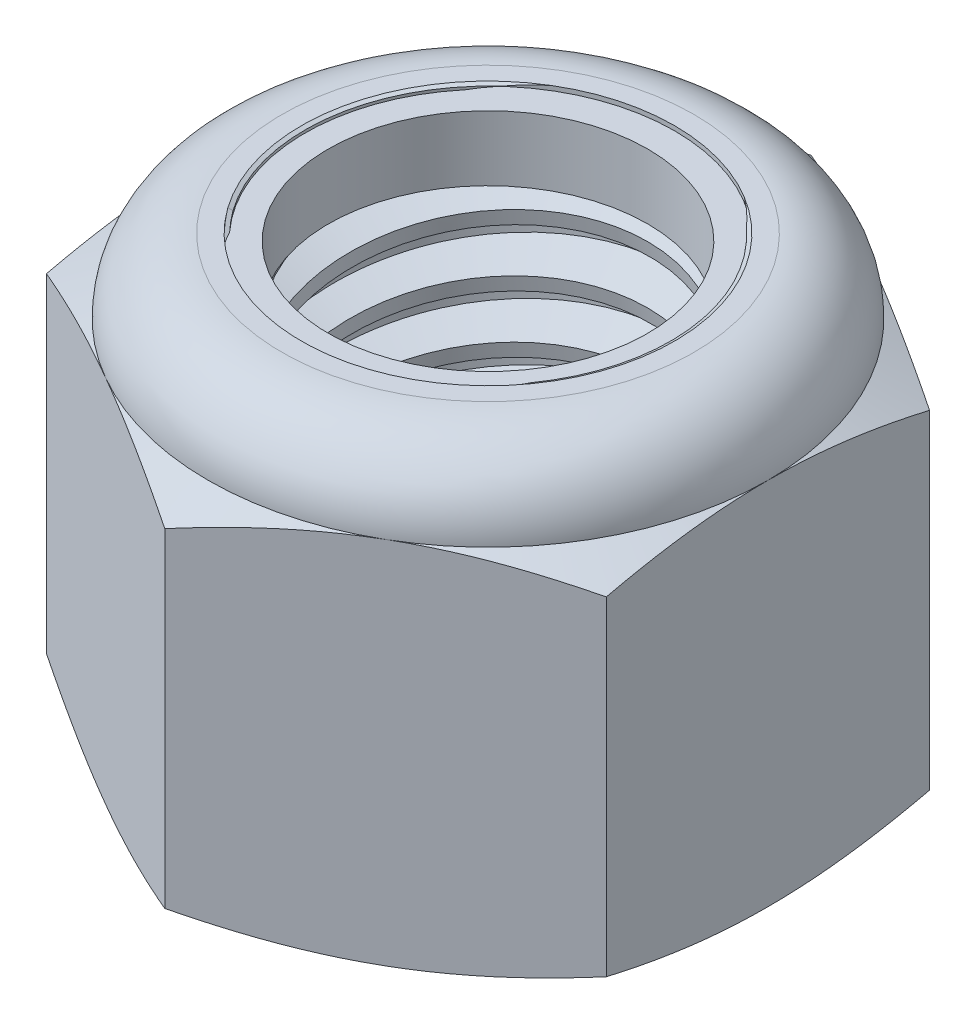
from build123d import *

# Parameters (mm, degrees)
EXTRUDE1_DEPTH       = 15.08125
SKETCH2_W            = 6.35
SKETCH2_H            = 15.08125
LPATTERN1_COUNT      = 8
LPATTERN1_PITCH      = 1.953846154
LPATTERN1_COUNT_DIR2 = 2
LPATTERN1_PITCH_DIR2 = 1.953846154


with BuildPart() as part:
    # Sketch1 → Extrude1 (new body)
    with BuildSketch(Plane(origin=(0, 0, 0), x_dir=(1, 0, 0), z_dir=(0, 1, 0))):
        Polygon((0, 10.998522628), (-9.525, 5.499261314), (-9.525, -5.499261314), (0, -10.998522628), (9.525, -5.499261314), (9.525, 5.499261314), align=None)
    extrude(amount=EXTRUDE1_DEPTH)

    # Sketch4 → Cut-Revolve2 (revolve, cut)
    with BuildSketch(Plane(origin=(0, 0, 0), x_dir=(0, 0, -1), z_dir=(1, 0, 0))):
        Polygon((0, 15.08125), (6.35, 15.08125), (5.434726912, 14.65445115), (5.434726912, 0.42679885), (6.35, 0), (0, 0), align=None)
    revolve(axis=Axis((0, 15.08125, 0), (0, 1, 0)), mode=Mode.SUBTRACT)


with BuildPart() as body_2:
    # Sketch2 → Revolve1 (revolve)
    with BuildSketch(Plane(origin=(0, 0, 0), x_dir=(0, 0, -1), z_dir=(1, 0, 0))):
        with Locations((3.175, 7.540625)):
            Rectangle(SKETCH2_W, SKETCH2_H)
    revolve(axis=Axis((0, -6.35, 0), (0, 1, 0)))

    # Sketch3 → Cut-Revolve1 (revolve, cut)
    with BuildSketch(Plane(origin=(0, 0, 0), x_dir=(0, 0, -1), z_dir=(1, 0, 0))):
        Polygon((6.387137043, 14.83985922), (6.647096345, 13.15012376), (5.509000998, 13.592792596), (5.434726912, 14.075574156), align=None)
    cut_revolve1 = revolve(axis=Axis((0, 15.08125, 0.321367977), (0, -0.9883716976506172, -0.15205718425394146)), mode=Mode.SUBTRACT)

    # LPattern1: Cut-Revolve1 8 × 2
    with Locations(*[Vector(0, -1, 0) * (i * LPATTERN1_PITCH) + Vector(0, 1, 0) * (j * LPATTERN1_PITCH_DIR2) for i in range(LPATTERN1_COUNT) for j in range(LPATTERN1_COUNT_DIR2) if (i, j) != (0, 0)]):
        add(cut_revolve1, mode=Mode.SUBTRACT)


with BuildPart() as part_1:
    add(part.part)

    # Combine1: cut body 2
    add(body_2.part, mode=Mode.SUBTRACT)

    # Sketch5 → Cut-Revolve3 (revolve, cut)
    with BuildSketch(Plane(origin=(0, 0, 0), x_dir=(0, 0, -1), z_dir=(1, 0, 0))):
        with BuildLine():
            Line((0, 0), (9.525, 0))
            Line((9.525, 0), (10.998522628, 0.687114886))
            Line((10.998522628, 0.687114886), (10.998522628, 11.880593447))
            Line((10.998522628, 11.880593447), (9.525, 12.567708333))
            ThreePointArc((9.525, 12.567708333), (8.788800691, 14.345050691), (7.011458333, 15.08125))
            Line((7.011458333, 15.08125), (7.011458333, 16.35125))
            Line((7.011458333, 16.35125), (12.268522628, 16.35125))
            Line((12.268522628, 16.35125), (12.268522628, -1.27))
            Line((12.268522628, -1.27), (0, -1.27))
            Line((0, -1.27), (0, 0))
        make_face()
    revolve(axis=Axis((0, 0, 0), (0, 1, 0)), mode=Mode.SUBTRACT)

    # Sketch6 → Cut-Revolve4 (revolve, cut)
    with BuildSketch(Plane(origin=(0, 0, 0), x_dir=(0, 0, -1), z_dir=(1, 0, 0))):
        with BuildLine():
            Line((0, 12.567708333), (9.3726, 12.567708333))
            ThreePointArc((9.3726, 12.567708333), (8.681037617, 14.237287617), (7.011458333, 14.92885))
            Line((7.011458333, 14.92885), (6.223092623, 14.92885))
            Line((6.223092623, 14.92885), (6.223092623, 16.35125))
            Line((6.223092623, 16.35125), (0, 16.35125))
            Line((0, 16.35125), (0, 12.567708333))
        make_face()
    revolve(axis=Axis((0, 16.35125, 0), (0, 1, 0)), mode=Mode.SUBTRACT)


with BuildPart() as body_2_2:
    # Sketch7 → Revolve2 (revolve)
    with BuildSketch(Plane(origin=(0, 0, 0), x_dir=(0, 0, -1), z_dir=(1, 0, 0))):
        with BuildLine():
            Line((5.434726912, 12.643908333), (9.295129058, 12.643908333))
            ThreePointArc((9.295129058, 12.643908333), (8.599986877, 14.210125907), (7.011458333, 14.85265))
            Line((7.011458333, 14.85265), (5.434726912, 14.85265))
            Line((5.434726912, 14.85265), (5.434726912, 12.643908333))
        make_face()
    revolve(axis=Axis((0, 12.643908333, 0), (0, 1, 0)))


solid = Compound([part_1.part, body_2_2.part])
